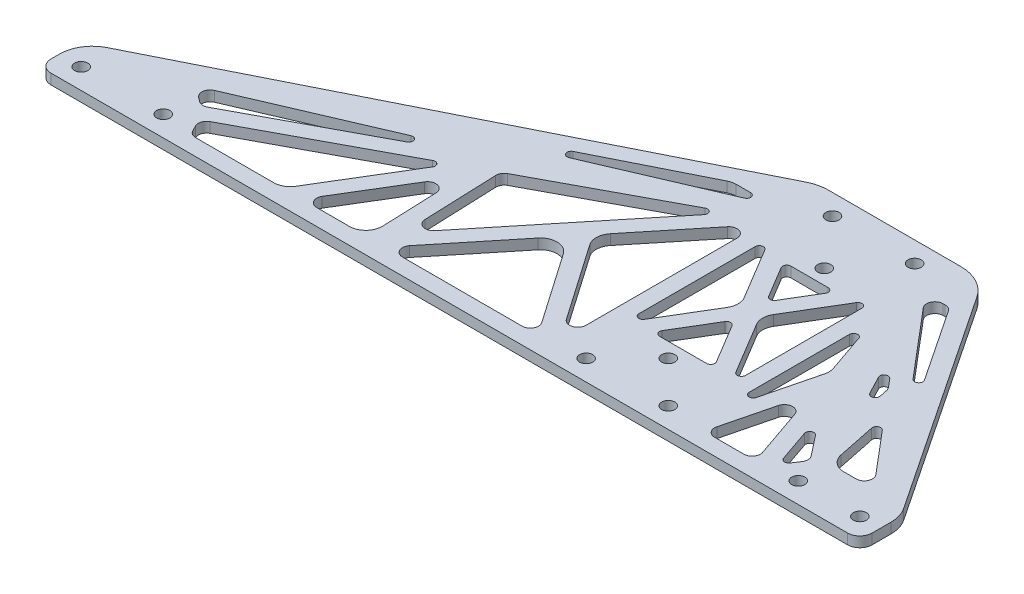
from build123d import *

# Parameters (mm, degrees)
SKETCH1_R           = 2.032
BOSS_EXTRUDE1_DEPTH = 3.175
SKETCH1_3_R         = 2.032
CUT_EXTRUDE2_DEPTH  = 270.126904313
FILLET1_R           = 3.81
FILLET2_R           = 10.16
FILLET3_R           = 12.7
FILLET4_R           = 1.27
FILLET5_R           = 2.54
FILLET6_R           = 5.08


with BuildPart() as part:
    # Sketch1 → Boss-Extrude1 (new body)
    with BuildSketch(Plane(origin=(0, 0, 0), x_dir=(1, 0, 0), z_dir=(0, 1, 0))):
        Polygon((0, 0), (254, 0), (254, 12.7), (203.2, 88.9), (152.4, 88.9), (0, 12.7), align=None)
        with Locations((6.773333333, 6.35)):
            Circle(SKETCH1_R, mode=Mode.SUBTRACT)
        with Locations((32.173333333, 6.35)):
            Circle(SKETCH1_R, mode=Mode.SUBTRACT)
        with Locations((228.6, 6.35)):
            Circle(SKETCH1_R, mode=Mode.SUBTRACT)
        with Locations((247.65, 6.35)):
            Circle(SKETCH1_R, mode=Mode.SUBTRACT)
        with Locations((162.983333333, 82.55)):
            Circle(SKETCH1_R, mode=Mode.SUBTRACT)
        with Locations((188.383333333, 82.55)):
            Circle(SKETCH1_R, mode=Mode.SUBTRACT)
    extrude(amount=BOSS_EXTRUDE1_DEPTH)

    # Sketch1<3> → Cut-Extrude2 (cut, through all)
    with BuildSketch(Plane(origin=(0, 0, 0), x_dir=(1, 0, 0), z_dir=(0, 1, 0))):
        Polygon((39.160127309, 10.433958769), (41.874510307, 5.08), (70.459110655, 5.08), (90.331883407, 37.826895453), align=None)
        Polygon((76.401361816, 5.08), (96.288373818, 5.08), (95.107733837, 35.904868603), align=None)
        Polygon((127.570752901, 36.414671497), (102.103358932, 5.08), (149.298298116, 5.08), align=None)
        Polygon((150.195302167, 76.2), (138.359225326, 76.2), (66.419120067, 40.229947371), align=None)
        Polygon((29.646805141, 18.912972806), (35.757110623, 14.374351834), (103.353340378, 50.559532546), align=None)
        Polygon((154.093333333, 69.047627429), (130.906568677, 40.519005519), (154.093333333, 7.079901082), align=None)
        Polygon((146.694432915, 67.998534414), (99.921228518, 42.960202251), (101.110396846, 11.912670369), align=None)
        with Locations((162.983333333, 6.35)):
            Circle(SKETCH1_3_R)
        Polygon((233.45048443, 34.366173115), (205.561266507, 76.2), (198.060312203, 76.2), align=None)
        Polygon((207.411621605, 31.741918623), (200.727780974, 5.08), (216.626583121, 5.08), align=None)
        with Locations((188.383333333, 6.35)):
            Circle(SKETCH1_3_R)
        Polygon((214.360813589, 27.186853093), (221.088734871, 7.720760975), (225.03662739, 13.595166828), align=None)
        Polygon((197.273333333, 61.075325647), (197.273333333, 12.191395039), (204.376138918, 40.524569775), align=None)
        Polygon((172.721209771, 44.45), (159.173333333, 67.029794062), (159.173333333, 21.870205938), align=None)
        Polygon((183.694009771, 62.738), (167.672656896, 62.738), (175.683333333, 49.386872604), align=None)
        Polygon((229.119714982, 15.811166321), (242.49351009, 15.811166321), (224.788319061, 36.740024529), align=None)
        Polygon((217.920532914, 44.858260713), (207.815682967, 56.802948088), (220.392582257, 32.913573338), align=None)
        Polygon((185.218009771, 23.622), (175.683333333, 39.513127396), (166.148656896, 23.622), align=None)
        Polygon((192.193333333, 21.870205938), (192.193333333, 67.029794062), (178.645456896, 44.45), align=None)
        with Locations((175.683333333, 19.05)):
            Circle(SKETCH1_3_R)
        with Locations((175.683333333, 67.31)):
            Circle(SKETCH1_3_R)
    extrude(amount=CUT_EXTRUDE2_DEPTH, mode=Mode.SUBTRACT)

    # Fillet1
    fillet1_edges = [part.edges().sort_by_distance(p)[0] for p in [
        (254, 1.5875, 0),
        (0, 1.5875, 0),
    ]]
    fillet(fillet1_edges, radius=FILLET1_R)

    # Fillet2
    fillet2_edges = [part.edges().sort_by_distance(p)[0] for p in [
        (254, 1.5875, -12.7),
        (0, 1.5875, -12.7),
    ]]
    fillet(fillet2_edges, radius=FILLET2_R)

    # Fillet3
    fillet3_edges = [part.edges().sort_by_distance(p)[0] for p in [
        (203.2, 1.5875, -88.9),
        (152.4, 1.5875, -88.9),
    ]]
    fillet(fillet3_edges, radius=FILLET3_R)

    # Fillet4
    fillet4_edges = [part.edges().sort_by_distance(p)[0] for p in [
        (214.360813589, 1.5875, -27.186853093),
        (233.45048443, 1.5875, -34.366173115),
        (207.815682967, 1.5875, -56.802948088),
        (220.392582257, 1.5875, -32.913573338),
        (197.273333333, 1.5875, -61.075325647),
        (197.273333333, 1.5875, -12.191395039),
        (159.173333333, 1.5875, -67.029794062),
        (192.193333333, 1.5875, -67.029794062),
        (192.193333333, 1.5875, -21.870205938),
        (159.173333333, 1.5875, -21.870205938),
        (146.694432915, 1.5875, -67.998534414),
        (66.419120067, 1.5875, -40.229947371),
        (150.195302167, 1.5875, -76.2),
        (224.788319061, 1.5875, -36.740024529),
        (103.353340378, 1.5875, -50.559532546),
        (90.331883407, 1.5875, -37.826895453),
        (183.694009771, 1.5875, -62.738),
        (167.672656896, 1.5875, -62.738),
        (175.683333333, 1.5875, -49.386872604),
        (185.218009771, 1.5875, -23.622),
        (166.148656896, 1.5875, -23.622),
        (175.683333333, 1.5875, -39.513127396),
        (221.088734871, 1.5875, -7.720760975),
    ]]
    fillet(fillet4_edges, radius=FILLET4_R)

    # Fillet5
    fillet5_edges = [part.edges().sort_by_distance(p)[0] for p in [
        (39.160127309, 1.5875, -10.433958769),
        (41.874510307, 1.5875, -5.08),
        (99.921228518, 1.5875, -42.960202251),
        (101.110396846, 1.5875, -11.912670369),
        (95.107733837, 1.5875, -35.904868603),
        (76.401361816, 1.5875, -5.08),
        (35.757110623, 1.5875, -14.374351834),
        (29.646805141, 1.5875, -18.912972806),
        (198.060312203, 1.5875, -76.2),
        (205.561266507, 1.5875, -76.2),
        (217.920532914, 1.5875, -44.858260713),
        (242.49351009, 1.5875, -15.811166321),
        (216.626583121, 1.5875, -5.08),
        (200.727780974, 1.5875, -5.08),
        (207.411621605, 1.5875, -31.741918623),
        (154.093333333, 1.5875, -69.047627429),
        (149.298298116, 1.5875, -5.08),
        (102.103358932, 1.5875, -5.08),
        (154.093333333, 1.5875, -7.079901082),
        (225.03662739, 1.5875, -13.595166828),
    ]]
    fillet(fillet5_edges, radius=FILLET5_R)

    # Fillet6
    fillet6_edges = [part.edges().sort_by_distance(p)[0] for p in [
        (229.119714982, 1.5875, -15.811166321),
        (96.288373818, 1.5875, -5.08),
        (172.721209771, 1.5875, -44.45),
        (178.645456896, 1.5875, -44.45),
        (130.906568677, 1.5875, -40.519005519),
        (127.570752901, 1.5875, -36.414671497),
        (138.359225326, 1.5875, -76.2),
        (70.459110655, 1.5875, -5.08),
        (204.376138918, 1.5875, -40.524569775),
    ]]
    fillet(fillet6_edges, radius=FILLET6_R)


solid = part.part
